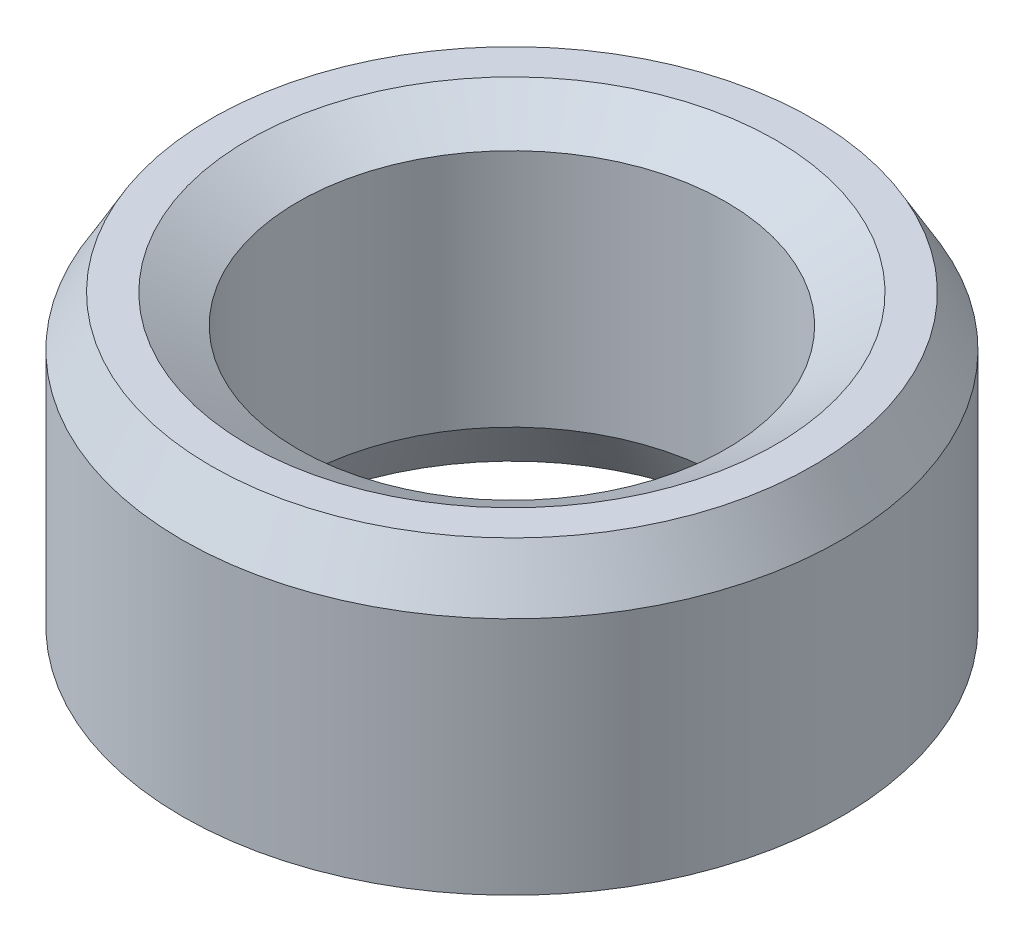
from build123d import *
from OCP.BRepFilletAPI import BRepFilletAPI_MakeChamfer

# Parameters (mm, degrees)
SKETCH1_R           = 7.5
BOSS_EXTRUDE1_DEPTH = 7.234367348
SKETCH2_R           = 4.87186033
CUT_EXTRUDE1_DEPTH  = 13.838850062
CHAMFER1_SIZE       = 1.1324513
CHAMFER1_SIZE2      = 0.653821063


with BuildPart() as part:
    # Sketch1 → Boss-Extrude1 (new body)
    with BuildSketch(Plane(origin=(0, 0, 0), x_dir=(1, 0, 0), z_dir=(0, 1, 0))):
        Circle(SKETCH1_R)
    extrude(amount=BOSS_EXTRUDE1_DEPTH)

    # Sketch2 → Cut-Extrude1 (cut, through all)
    with BuildSketch(Plane(origin=(0, 0, 0), x_dir=(1, 0, 0), z_dir=(0, 1, 0))):
        Circle(SKETCH2_R)
    extrude(amount=CUT_EXTRUDE1_DEPTH, mode=Mode.SUBTRACT)

    # Chamfer1: one chamfer whose edges measure the first distance from different faces: ONE call of the kernel's chamfer builder (chamfer() names one face for all edges)
    chamfer1_edges_1 = [part.edges().sort_by_distance(p)[0] for p in [
        (-4.87186033, 7.234367348, 0),
    ]]
    chamfer1_side_1 = [part.faces().sort_by_distance(p)[0] for p in [
        (-7.287867966, 7.234367348, 0),
    ]]
    chamfer1_edges_2 = [part.edges().sort_by_distance(p)[0] for p in [
        (-4.87186033, 0, 0),
    ]]
    chamfer1_side_2 = [part.faces().sort_by_distance(p)[0] for p in [
        (-4.87186033, 3.617183674, 0),
    ]]
    chamfer1_edges_3 = [part.edges().sort_by_distance(p)[0] for p in [
        (-7.5, 0, 0),
    ]]
    chamfer1_side_3 = [part.faces().sort_by_distance(p)[0] for p in [
        (-7.287867966, 0, 0),
    ]]
    chamfer1_edges_4 = [part.edges().sort_by_distance(p)[0] for p in [
        (-7.5, 7.234367348, 0),
    ]]
    chamfer1_side_4 = [part.faces().sort_by_distance(p)[0] for p in [
        (-7.5, 3.617183674, 0),
    ]]
    chamfer1 = BRepFilletAPI_MakeChamfer(part.part.solid().wrapped)
    for e in chamfer1_edges_1:
        chamfer1.Add(CHAMFER1_SIZE, CHAMFER1_SIZE2, e.wrapped, chamfer1_side_1[0].wrapped)  # the first distance lies on this face
    for e in chamfer1_edges_2:
        chamfer1.Add(CHAMFER1_SIZE, CHAMFER1_SIZE2, e.wrapped, chamfer1_side_2[0].wrapped)  # the first distance lies on this face
    for e in chamfer1_edges_3:
        chamfer1.Add(CHAMFER1_SIZE, CHAMFER1_SIZE2, e.wrapped, chamfer1_side_3[0].wrapped)  # the first distance lies on this face
    for e in chamfer1_edges_4:
        chamfer1.Add(CHAMFER1_SIZE, CHAMFER1_SIZE2, e.wrapped, chamfer1_side_4[0].wrapped)  # the first distance lies on this face
    add(Compound.cast(chamfer1.Shape()), mode=Mode.REPLACE)


solid = part.part
